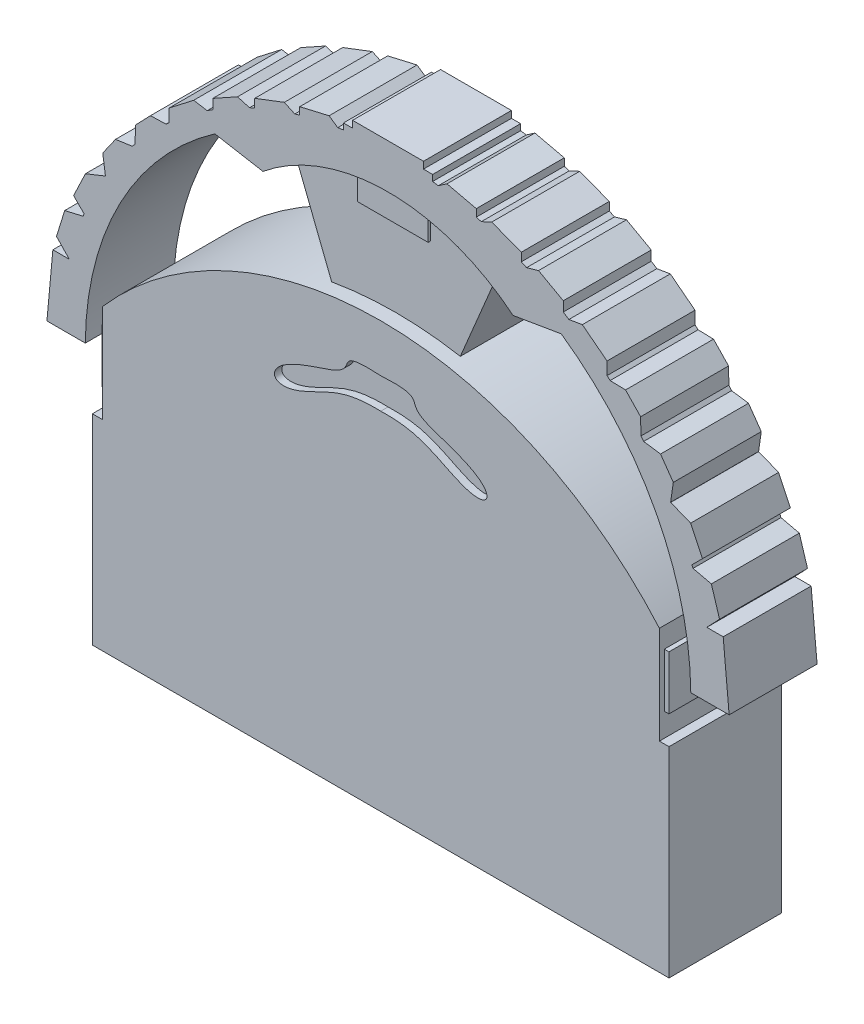
from build123d import *

# Parameters (mm, degrees)
SKETCH1_W            = 11.8
SKETCH1_H            = 4.1
BOSS_EXTRUDE1_DEPTH  = 2.3
SKETCH2_W            = 11.4
SKETCH2_H            = 2
BOSS_EXTRUDE2_DEPTH  = 2.3
BOSS_EXTRUDE3_START  = -0.1
SKETCH3_W            = 1
SKETCH3_H            = 1.1
BOSS_EXTRUDE3_DEPTH  = 2.3
BOSS_EXTRUDE4_START  = -0.1
SKETCH4_W            = 1.5
SKETCH4_H            = 1
BOSS_EXTRUDE4_DEPTH  = 0.4
LPATTERN1_COUNT      = 2
LPATTERN1_PITCH      = 2.5
LPATTERN1_COL_COUNT  = 2
LPATTERN1_COL_PITCH  = 2.5
BOSS_EXTRUDE5_DEPTH  = 2.3
CUT_EXTRUDE1_START   = 2.15
CUT_EXTRUDE1_DEPTH   = 0.15
BOSS_EXTRUDE6_START  = 0.1
SKETCH9_W            = 1.451153264
SKETCH9_H            = 0.139855477
SKETCH9_H_2          = 0.01502842
BOSS_EXTRUDE6_DEPTH  = 0.9
BOSS_EXTRUDE7_START  = 0.2
BOSS_EXTRUDE7_DEPTH  = 0.65
BOSS_EXTRUDE8_START  = 0.1
SKETCH12_W           = 1.44617415
SKETCH12_H           = 1.169902142
BOSS_EXTRUDE8_DEPTH  = 0.8
BOSS_EXTRUDE9_START  = 0.1
BOSS_EXTRUDE9_DEPTH  = 0.9
BOSS_EXTRUDE11_START = 0.1
BOSS_EXTRUDE11_DEPTH = 0.9


# Read off the part's stored shape, not the designer's step: Cut-Extrude1
with BuildPart() as part:
    # Sketch1 → Boss-Extrude1 (new body)
    with BuildSketch(Plane.XY):
        with Locations((5.9, 2.05)):
            Rectangle(SKETCH1_W, SKETCH1_H)
    extrude(amount=BOSS_EXTRUDE1_DEPTH)

    # Sketch2 → Boss-Extrude2 (add)
    with BuildSketch(Plane.XY):
        with Locations((5.903416876, 5.1)):
            Rectangle(SKETCH2_W, SKETCH2_H)
    extrude(amount=BOSS_EXTRUDE2_DEPTH)

    # Sketch3 → Boss-Extrude3 (add)
    with BuildSketch(Plane.XY.offset(BOSS_EXTRUDE3_START)):
        with Locations((0.601708438, 5.129355756)):
            Rectangle(SKETCH3_W, SKETCH3_H)
    boss_extrude3 = extrude(amount=BOSS_EXTRUDE3_DEPTH)

    # Mirror1: Boss-Extrude3 across plane
    add(boss_extrude3.mirror(Plane(origin=(5.9, 0, 0), x_dir=(0, 0, 1), z_dir=(1, 0, 0))))

    # Sketch4 → Boss-Extrude4 (add)
    with BuildSketch(Plane.XY.offset(BOSS_EXTRUDE4_START)):
        with Locations((5.898460375, 0.392479358)):
            Rectangle(SKETCH4_W, SKETCH4_H)
    boss_extrude4 = extrude(amount=BOSS_EXTRUDE4_DEPTH)

    # LPattern1: Boss-Extrude4 ×2
    with Locations(*[(i * LPATTERN1_PITCH, 0, 0) for i in range(1, LPATTERN1_COUNT)]):
        add(boss_extrude4)

    # LPattern1 col: Boss-Extrude4 ×2
    with Locations(*[(-i * LPATTERN1_COL_PITCH, 0, 0) for i in range(1, LPATTERN1_COL_COUNT)]):
        add(boss_extrude4)

    # Sketch7 → Boss-Extrude5 (add)
    with BuildSketch(Plane.XY):
        with BuildLine():
            Line((0.203416876, 6.1), (11.603416876, 6.1))
            ThreePointArc((11.603416876, 6.1), (5.903416876, 8.699567422), (0.203416876, 6.1))
        make_face()
    extrude(amount=BOSS_EXTRUDE5_DEPTH)

    # Cut-Extrude1 outline → Cut-Extrude1 (cut)
    with BuildSketch(Plane.XY.offset(CUT_EXTRUDE1_START)):
        with BuildLine():
            Line((5.9, 7.095183964), (5.9, 7.724501792))
            add(Edge.make_bspline(
                [(5.9, 7.724501792), (4.326937108, 7.822520939), (5.9, 7.319656572), (5.448711465, 7.255186781), (4.069057945, 7.229398865), (3.669345243, 7.087565325), (3.869201594, 7.158482095), (2.225221932, 6.120518466), (4.455876689, 6.146306382), (3.954545764, 6.281675552), (4.752437726, 7.113353242), (4.855589391, 7.061777409), (5.620353503, 7.110533179), (5.9, 7.095183964)],
                knots=[0, 0, 0, 0, 0, 0, 0, 0, 0, 0, 0, 0, 0, 0, 1, 1, 1, 1, 1, 1, 1, 1, 1, 1, 1, 1, 1, 1], degree=13))
        make_face()
    cut_extrude1 = extrude(amount=CUT_EXTRUDE1_DEPTH, mode=Mode.SUBTRACT)

    # Mirror2: Cut-Extrude1 across plane
    add(cut_extrude1.mirror(Plane(origin=(5.9, 0, 0), x_dir=(0, 0, 1), z_dir=(1, 0, 0))), mode=Mode.SUBTRACT)



with BuildPart() as body_2:
    # Sketch9 → Boss-Extrude6 (new, symmetric)
    with BuildSketch(Plane.XY.offset(1.15).offset(BOSS_EXTRUDE6_START)):
        with BuildLine():
            Line((2.355610817, 10.163701862), (3.34041857, 9.990053684))
            ThreePointArc((3.34041857, 9.990053684), (5.898836859, 10.90755899), (8.459580179, 9.996562953))
            Line((8.459580179, 9.996562953), (9.445513537, 10.163701862))
            ThreePointArc((9.445513537, 10.163701862), (5.900562177, 11.27807609), (2.355610817, 10.163701862))
        make_face()
        with BuildLine():
            ThreePointArc((-0.294894362, 5.129355756), (0.418313853, 7.968760684), (2.355610817, 10.163701862))
            ThreePointArc((2.355610817, 10.163701862), (5.900562177, 11.27807609), (9.445513537, 10.163701862))
            ThreePointArc((9.445513537, 10.163701862), (11.3828105, 7.968760684), (12.096018715, 5.129355756))
            Line((12.096018715, 5.129355756), (12.600483369, 5.129355756))
            ThreePointArc((12.600483369, 5.129355756), (10.879374358, 9.395993369), (6.813193458, 11.548337589))
            Line((6.813193458, 11.548337589), (6.625730117, 11.548337589))
            Line((6.625730117, 11.548337589), (6.625730117, 11.533309169))
            Line((6.625730117, 11.533309169), (5.174576853, 11.533309169))
            Line((5.174576853, 11.533309169), (5.174576853, 11.548337589))
            Line((5.174576853, 11.548337589), (4.987930896, 11.548337589))
            ThreePointArc((4.987930896, 11.548337589), (0.921749996, 9.395993369), (-0.799359016, 5.129355756))
            Line((-0.799359016, 5.129355756), (-0.294894362, 5.129355756))
        make_face()
        with Locations((5.900153485, 11.743092386)):
            Rectangle(SKETCH9_W, SKETCH9_H)
        with BuildLine():
            Line((5.174576853, 11.673164647), (5.174576853, 11.571323885))
            ThreePointArc((5.174576853, 11.571323885), (5.90015107, 11.610751105), (6.625730117, 11.571412879))
            Line((6.625730117, 11.571412879), (6.625730117, 11.673164647))
            Line((6.625730117, 11.673164647), (5.174576853, 11.673164647))
        make_face()
        with BuildLine():
            ThreePointArc((6.625730117, 11.571412879), (6.719543062, 11.560535503), (6.813193458, 11.548337589))
            Line((6.813193458, 11.548337589), (6.813193458, 11.673164647))
            Line((6.813193458, 11.673164647), (6.625730117, 11.673164647))
            Line((6.625730117, 11.673164647), (6.625730117, 11.571412879))
        make_face()
        with BuildLine():
            Line((4.987930896, 11.673164647), (4.987930896, 11.548337589))
            ThreePointArc((4.987930896, 11.548337589), (5.081173266, 11.560485266), (5.174576853, 11.571323885))
            Line((5.174576853, 11.571323885), (5.174576853, 11.673164647))
            Line((5.174576853, 11.673164647), (4.987930896, 11.673164647))
        make_face()
        with BuildLine():
            Line((5.174576853, 11.571323885), (5.174576853, 11.548337589))
            Line((5.174576853, 11.548337589), (6.625730117, 11.548337589))
            Line((6.625730117, 11.548337589), (6.625730117, 11.571412879))
            ThreePointArc((6.625730117, 11.571412879), (5.90015107, 11.610751105), (5.174576853, 11.571323885))
        make_face()
        with BuildLine():
            ThreePointArc((5.174576853, 11.571323885), (5.081173266, 11.560485266), (4.987930896, 11.548337589))
            Line((4.987930896, 11.548337589), (5.174576853, 11.548337589))
            Line((5.174576853, 11.548337589), (5.174576853, 11.571323885))
        make_face()
        with Locations((5.900153485, 11.540823379)):
            Rectangle(SKETCH9_W, SKETCH9_H_2)
        with BuildLine():
            Line((6.625730117, 11.548337589), (6.813193458, 11.548337589))
            ThreePointArc((6.813193458, 11.548337589), (6.719543062, 11.560535503), (6.625730117, 11.571412879))
            Line((6.625730117, 11.571412879), (6.625730117, 11.548337589))
        make_face()
    extrude(amount=BOSS_EXTRUDE6_DEPTH, both=True)



with BuildPart() as body_3:
    # Sketch11 → Boss-Extrude7 (new, symmetric)
    with BuildSketch(Plane.XY.offset(1.15).offset(BOSS_EXTRUDE7_START)):
        Polygon((8.224851185, 10.954397565), (5.972117123, 10.954397565), (3.66431816, 10.954397565), (4.823471696, 8.00789138), (5.903471696, 8.00789138), (6.988471696, 8.00789138), align=None)
    extrude(amount=BOSS_EXTRUDE7_DEPTH, both=True)


with BuildPart() as body_2_1:
    add(body_2.part)

    add(body_3.part)  # Boss-Extrude8 merges body 3
    # Sketch12 → Boss-Extrude8 (add, symmetric)
    with BuildSketch(Plane.XY.offset(1.15).offset(BOSS_EXTRUDE8_START)):
        with Locations((5.898836859, 10.90755899)):
            Rectangle(SKETCH12_W, SKETCH12_H)
    extrude(amount=BOSS_EXTRUDE8_DEPTH, both=True)

    # Sketch13 → Boss-Extrude9 (add, symmetric)
    with BuildSketch(Plane.XY.offset(1.15).offset(BOSS_EXTRUDE9_START)):
        Polygon((-1.08075819, 5.129355756), (-0.799359016, 5.129355756), (-0.671141909, 6.202084295), (-0.605509207, 6.451748475), (-0.958965207, 6.451748475), align=None)
    boss_extrude9 = extrude(amount=BOSS_EXTRUDE9_DEPTH, both=True)

    # Mirror3: Boss-Extrude9 across plane
    add(boss_extrude9.mirror(Plane(origin=(5.9, 0, 0), x_dir=(0, 0, 1), z_dir=(1, 0, 0))))


with BuildPart() as part_1:
    add(part.part)

    add(body_2_1.part)  # Boss-Extrude11 merges body 2
    # Sketch14 → Boss-Extrude11 (add, symmetric)
    with BuildSketch(Plane.XY.offset(1.15).offset(BOSS_EXTRUDE11_START)):
        Polygon((4.09350701, 11.514168222), (4.693813808, 11.65328598), (4.987930896, 11.450470962), (4.09350701, 11.286137141), align=None)
        Polygon((3.172552888, 11.201783695), (3.777829994, 11.433223707), (4.09350701, 11.286137141), (3.172552888, 10.950622256), align=None)
        Polygon((2.313751368, 10.77100106), (2.820138748, 11.052647163), (3.172552888, 10.950622256), (2.313751368, 10.477435247), align=None)
        Polygon((1.417632483, 10.151446182), (1.92347576, 10.542406597), (2.313751368, 10.477435247), (1.417632483, 9.837098648), align=None)
        Polygon((0.730905136, 9.506715824), (1.038871241, 9.827727461), (1.417632483, 9.837098648), (0.723421169, 9.107663948), align=None)
        Polygon((0.061798131, 8.677620181), (0.323212614, 9.049883319), (0.723421169, 9.107663948), (0.116840619, 8.296376932), align=None)
        Polygon((-0.534407657, 7.623618076), (-0.292532583, 8.132380345), (0.116840619, 8.296376932), (-0.279961599, 7.369172018), align=None)
        Polygon((-0.279961599, 7.369172018), (-0.716747876, 7.268090769), (-0.884396434, 6.725317521), (-0.622667426, 6.451748475), align=None)
    boss_extrude11 = extrude(amount=BOSS_EXTRUDE11_DEPTH, both=True)

    # Mirror4: Boss-Extrude11 across plane
    add(boss_extrude11.mirror(Plane(origin=(5.9, 0, 0), x_dir=(0, 0, 1), z_dir=(1, 0, 0))))


solid = part_1.part
